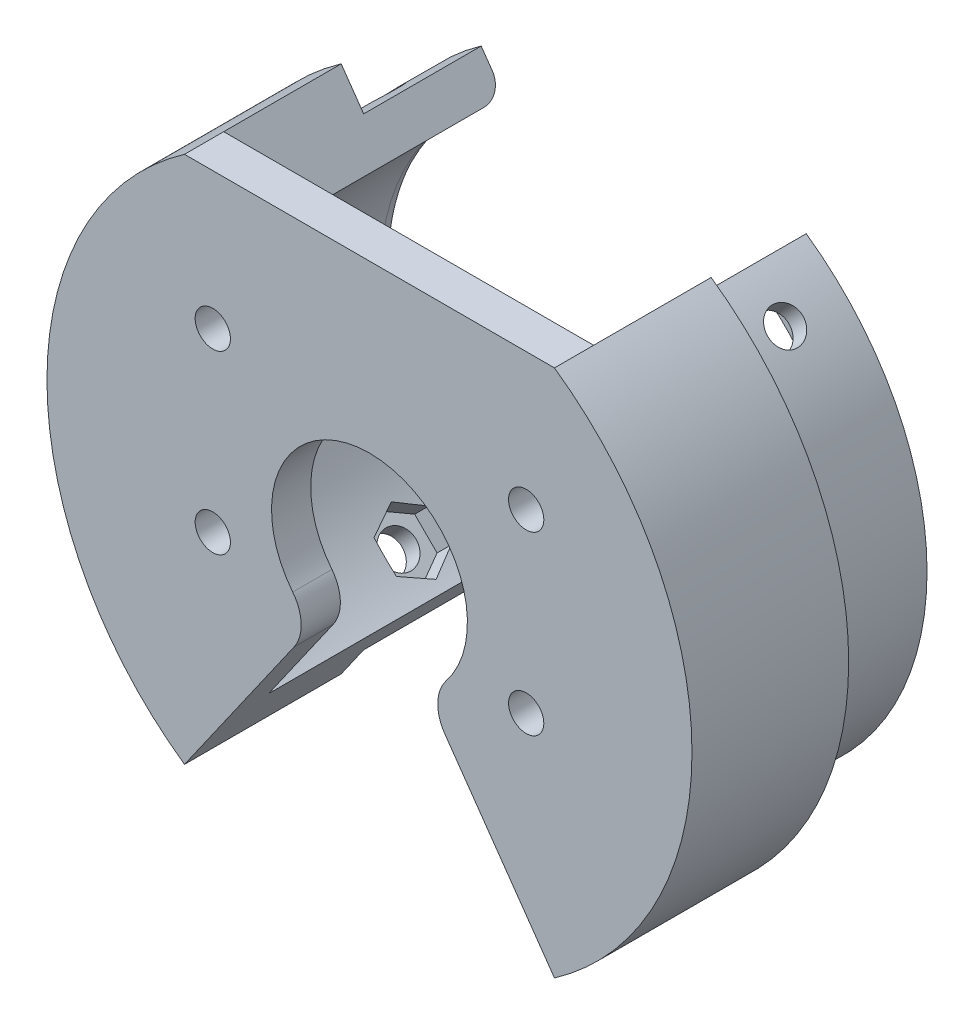
from build123d import *
from build123d.topology import SkipClean

# Parameters (mm, degrees)
SKETCH1_R               = 36.16223967
SKETCH1_R_2             = 31.16223967
BOSS_EXTRUDE1_DEPTH     = 7.5
CUT_EXTRUDE1_DEPTH      = 52.688152955
BOSS_EXTRUDE2_DEPTH     = 15
BOSS_EXTRUDE3_DEPTH     = 5
CUT_EXTRUDE2_START      = -10
SKETCH8_R               = 2.25
CUT_EXTRUDE2_DEPTH      = 99.64852107
CUT_EXTRUDE3_START      = -10
CUT_EXTRUDE3_DEPTH      = 12.5
MIRROR3_START           = -10
MIRROR3_COPY_1_SKETCH_R = 2.25
MIRROR3_COPY_1_DEPTH    = 99.64852107
MIRROR3_COPY_2_DEPTH    = 12.5
MIRROR3_COPY_3_SKETCH_R = 2.25
MIRROR3_COPY_3_DEPTH    = 99.64852107
MIRROR3_COPY_4_DEPTH    = 12.5
CUT_EXTRUDE4_DEPTH      = 64.688636815
CUT_EXTRUDE4_DEPTH_BACK = 64.688636815
FILLET1_R               = 5
FILLET2_R               = 2.5
SKETCH11_R              = 2.25
EXAMPLE_MOUNT_DEPTH     = 64.688636815


with BuildPart() as part:
    # Sketch1 → Boss-Extrude1 (new, symmetric)
    with BuildSketch(Plane.XY):
        Circle(SKETCH1_R)
        Circle(SKETCH1_R_2, mode=Mode.SUBTRACT)
    extrude(amount=BOSS_EXTRUDE1_DEPTH, both=True)

    # Sketch2 → Cut-Extrude1 (cut, symmetric)
    with BuildSketch(Plane.XY):
        with BuildLine():
            Line((20.74180856, 29.622372552), (17.873926379, 25.52661233))
            ThreePointArc((17.873926379, 25.52661233), (0, 31.16223967), (-17.873926379, 25.52661233))
            Line((-17.873926379, 25.52661233), (-20.74180856, 29.622372552))
            ThreePointArc((-20.74180856, 29.622372552), (0, 36.16223967), (20.74180856, 29.622372552))
        make_face()
    cut_extrude1 = extrude(amount=CUT_EXTRUDE1_DEPTH, both=True, mode=Mode.SUBTRACT)

    # Mirror1: Cut-Extrude1 across plane
    add(cut_extrude1.mirror(Plane.ZX), mode=Mode.SUBTRACT)

    # Sketch3 → Boss-Extrude2 (add)
    with SkipClean():  # the faces are left unmerged after this step: merging them gives an invalid solid
        with BuildSketch(Plane.XY.offset(7.5)):
            with BuildLine():
                Line((-17.873926379, 25.52661233), (-23.609690742, 33.718132773))
                ThreePointArc((-23.609690742, 33.718132773), (-41.16223967, 0), (-23.609690742, -33.718132773))
                Line((-23.609690742, -33.718132773), (-17.873926379, -25.52661233))
                ThreePointArc((-17.873926379, -25.52661233), (-31.16223967, 0), (-17.873926379, 25.52661233))
            make_face()
            with BuildLine():
                Line((17.873926379, -25.52661233), (23.609690742, -33.718132773))
                ThreePointArc((23.609690742, -33.718132773), (41.16223967, 0), (23.609690742, 33.718132773))
                Line((23.609690742, 33.718132773), (17.873926379, 25.52661233))
                ThreePointArc((17.873926379, 25.52661233), (31.16223967, 0), (17.873926379, -25.52661233))
            make_face()
        extrude(amount=BOSS_EXTRUDE2_DEPTH)

    # Sketch4 → Boss-Extrude3 (add)
    with SkipClean():  # the faces are left unmerged after this step: merging them gives an invalid solid
        with BuildSketch(Plane.XY.offset(22.5)):
            with BuildLine():
                Line((23.609690742, 33.718132773), (-23.609690742, 33.718132773))
                ThreePointArc((-23.609690742, 33.718132773), (-41.16223967, 0), (-23.609690742, -33.718132773))
                Line((-23.609690742, -33.718132773), (23.609690742, -33.718132773))
                ThreePointArc((23.609690742, -33.718132773), (41.16223967, 0), (23.609690742, 33.718132773))
            make_face()
        extrude(amount=BOSS_EXTRUDE3_DEPTH)

    # Sketch8 → Cut-Extrude2 (cut)
    with SkipClean():  # the faces are left unmerged after this step: merging them gives an invalid solid
        with BuildSketch(Plane(origin=(22.035030988, 22.035030988, 0), x_dir=(0.7071067811865486, -0.7071067811865465, 0), z_dir=(0.7071067811865465, 0.7071067811865486, 0)).offset(CUT_EXTRUDE2_START)):
            Circle(SKETCH8_R)
        cut_extrude2 = extrude(amount=CUT_EXTRUDE2_DEPTH, mode=Mode.SUBTRACT)

    # Sketch9 → Cut-Extrude3 (cut)
    with SkipClean():  # the faces are left unmerged after this step: merging them gives an invalid solid
        with BuildSketch(Plane(origin=(22.035030988, 22.035030988, 0), x_dir=(0.7071067811865486, -0.7071067811865465, 0), z_dir=(0.7071067811865465, 0.7071067811865486, 0)).offset(CUT_EXTRUDE3_START)):
            Polygon((2.020725942, -3.5), (4.041451884, 0), (2.020725942, 3.5), (-2.020725942, 3.5), (-4.041451884, 0), (-2.020725942, -3.5), align=None)
        cut_extrude3 = extrude(amount=CUT_EXTRUDE3_DEPTH, mode=Mode.SUBTRACT)

    # Mirror2: Cut-Extrude2, Cut-Extrude3 across plane
    with SkipClean():  # the faces are left unmerged after this step: merging them gives an invalid solid
        add(cut_extrude2.mirror(Plane.ZX), mode=Mode.SUBTRACT)
        add(cut_extrude3.mirror(Plane.ZX), mode=Mode.SUBTRACT)

    # Mirror3 copy 1 sketch → Mirror3 copy 1 (cut)
    with SkipClean():  # the faces are left unmerged after this step: merging them gives an invalid solid
        with BuildSketch(Plane(origin=(-22.035030988, -22.035030988, 0), x_dir=(-0.7071067811865486, 0.7071067811865465, 0), z_dir=(-0.7071067811865465, -0.7071067811865486, 0)).offset(MIRROR3_START)):
            Circle(MIRROR3_COPY_1_SKETCH_R)
        extrude(amount=MIRROR3_COPY_1_DEPTH, mode=Mode.SUBTRACT)

    # Mirror3 copy 2 sketch → Mirror3 copy 2 (cut)
    with SkipClean():  # the faces are left unmerged after this step: merging them gives an invalid solid
        with BuildSketch(Plane(origin=(-22.035030988, -22.035030988, 0), x_dir=(-0.7071067811865486, 0.7071067811865465, 0), z_dir=(-0.7071067811865465, -0.7071067811865486, 0)).offset(MIRROR3_START)):
            Polygon((2.020725942, -3.5), (4.041451884, 0), (2.020725942, 3.5), (-2.020725942, 3.5), (-4.041451884, 0), (-2.020725942, -3.5), align=None)
        extrude(amount=MIRROR3_COPY_2_DEPTH, mode=Mode.SUBTRACT)

    # Mirror3 copy 3 sketch → Mirror3 copy 3 (cut)
    with SkipClean():  # the faces are left unmerged after this step: merging them gives an invalid solid
        with BuildSketch(Plane(origin=(-22.035030988, 22.035030988, 0), x_dir=(-0.7071067811865486, -0.7071067811865465, 0), z_dir=(-0.7071067811865465, 0.7071067811865486, 0)).offset(MIRROR3_START)):
            Circle(MIRROR3_COPY_3_SKETCH_R)
        extrude(amount=MIRROR3_COPY_3_DEPTH, mode=Mode.SUBTRACT)

    # Mirror3 copy 4 sketch → Mirror3 copy 4 (cut)
    with SkipClean():  # the faces are left unmerged after this step: merging them gives an invalid solid
        with BuildSketch(Plane(origin=(-22.035030988, 22.035030988, 0), x_dir=(-0.7071067811865486, -0.7071067811865465, 0), z_dir=(-0.7071067811865465, 0.7071067811865486, 0)).offset(MIRROR3_START)):
            Polygon((2.020725942, 3.5), (4.041451884, 0), (2.020725942, -3.5), (-2.020725942, -3.5), (-4.041451884, 0), (-2.020725942, 3.5), align=None)
        extrude(amount=MIRROR3_COPY_4_DEPTH, mode=Mode.SUBTRACT)

    # Sketch10 → Cut-Extrude4 (cut, two sides: drawn at the far end of the back side and taken through both)
    with SkipClean():  # the faces are left unmerged after this step: merging them gives an invalid solid
        with BuildSketch(Plane.XY.offset(27.5).offset(-CUT_EXTRUDE4_DEPTH_BACK)):
            with BuildLine():
                Line((-23.609690742, -33.718132773), (-7.169705454, -10.239400554))
                ThreePointArc((-7.169705454, -10.239400554), (0, 12.5), (7.169705454, -10.239400554))
                Line((7.169705454, -10.239400554), (23.609690742, -33.718132773))
                Line((23.609690742, -33.718132773), (-23.609690742, -33.718132773))
            make_face()
        extrude(amount=CUT_EXTRUDE4_DEPTH + CUT_EXTRUDE4_DEPTH_BACK, mode=Mode.SUBTRACT)

    # Fillet1
    fillet1_edges = [part.edges().sort_by_distance(p)[0] for p in [
        (7.169705454, -10.239400554, 25),
        (-7.169705454, -10.239400554, 25),
    ]]
    fillet(fillet1_edges, radius=FILLET1_R)

    # Fillet2
    fillet2_edges = [part.edges().sort_by_distance(p)[0] for p in [
        (31.16223967, 0, -7.5),
        (-31.16223967, 0, -7.5),
    ]]
    fillet(fillet2_edges, radius=FILLET2_R)

    # Sketch11 → example_mount (cut, through all)
    with SkipClean():  # the faces are left unmerged after this step: merging them gives an invalid solid
        with BuildSketch(Plane.XY.offset(27.5)):
            with Locations((-20, -6.25)):
                Circle(SKETCH11_R)
            with Locations((-20, 16.25)):
                Circle(SKETCH11_R)
            with Locations((20, 16.25)):
                Circle(SKETCH11_R)
            with Locations((20, -6.25)):
                Circle(SKETCH11_R)
        extrude(amount=-EXAMPLE_MOUNT_DEPTH, mode=Mode.SUBTRACT)


solid = part.part
